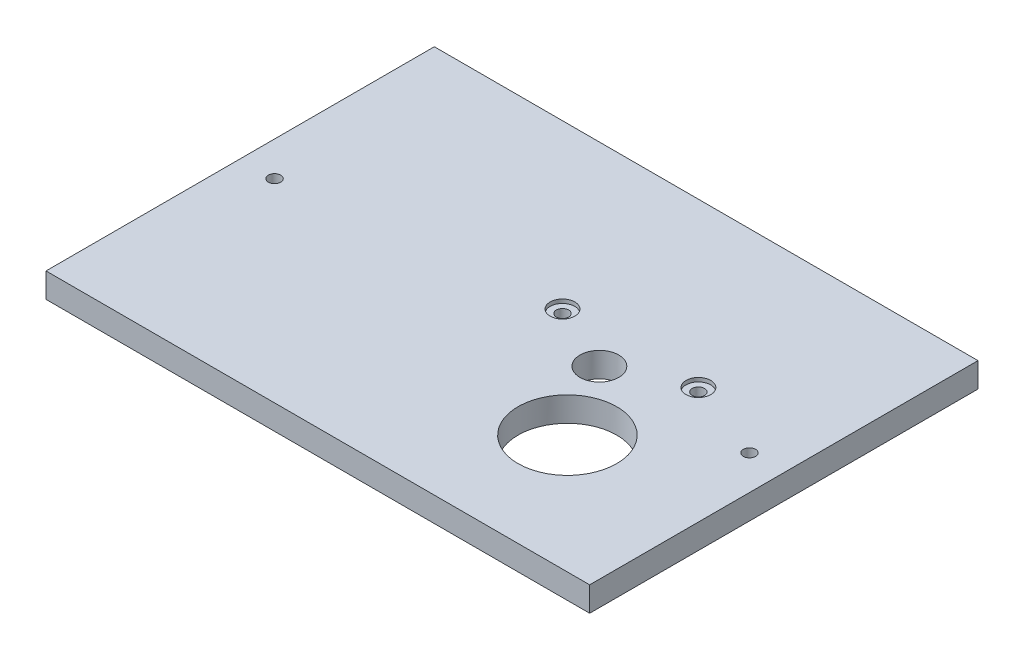
from build123d import *

# Parameters (mm, degrees)
SKETCH1_W           = 140
SKETCH1_H           = 100
BOSS_EXTRUDE1_DEPTH = 6.35
SKETCH2_R           = 12.705
SKETCH2_R_2         = 5
CUT_EXTRUDE1_DEPTH  = 10
SKETCH3_R           = 1.5875
CUT_EXTRUDE2_DEPTH  = 10
SKETCH4_R           = 3.175
SKETCH4_R_2         = 1.5875
CUT_EXTRUDE3_DEPTH  = 1


with BuildPart() as part:
    # Sketch1 → Boss-Extrude1 (new body)
    with BuildSketch(Plane(origin=(0, 0, 0), x_dir=(1, 0, 0), z_dir=(0, 1, 0))):
        with Locations((70, 50)):
            Rectangle(SKETCH1_W, SKETCH1_H)
    extrude(amount=BOSS_EXTRUDE1_DEPTH)

    # Sketch2 → Cut-Extrude1 (cut)
    with BuildSketch(Plane(origin=(0, 6.35, 0), x_dir=(1, 0, 0), z_dir=(0, 1, 0))):
        with Locations((103.75, 30.514428415)):
            Circle(SKETCH2_R)
        with Locations((92.5, 50)):
            Circle(SKETCH2_R_2)
    extrude(amount=-CUT_EXTRUDE1_DEPTH, mode=Mode.SUBTRACT)

    # Sketch3 → Cut-Extrude2 (cut)
    with BuildSketch(Plane(origin=(0, 6.35, 0), x_dir=(1, 0, 0), z_dir=(0, 1, 0))):
        with Locations((8.85, 50)):
            Circle(SKETCH3_R)
        with Locations((131.15, 50)):
            Circle(SKETCH3_R)
        with Locations((75, 58)):
            Circle(SKETCH3_R)
        with Locations((110, 58)):
            Circle(SKETCH3_R)
    extrude(amount=-CUT_EXTRUDE2_DEPTH, mode=Mode.SUBTRACT)

    # Sketch4 → Cut-Extrude3 (cut)
    # profile 1 of 2: a face of its own
    with BuildSketch(Plane(origin=(0, 6.35, 0), x_dir=(1, 0, 0), z_dir=(0, 1, 0))):
        with Locations((110, 58)):
            Circle(SKETCH4_R)
        with Locations((110, 58)):
            Circle(SKETCH4_R_2, mode=Mode.SUBTRACT)
    # profile 2 of 2: a face of its own
    with BuildSketch(Plane(origin=(0, 6.35, 0), x_dir=(1, 0, 0), z_dir=(0, 1, 0))):
        with Locations((75, 58)):
            Circle(SKETCH4_R)
        with Locations((75, 58)):
            Circle(SKETCH4_R_2, mode=Mode.SUBTRACT)
    extrude(amount=-CUT_EXTRUDE3_DEPTH, mode=Mode.SUBTRACT)


solid = part.part
